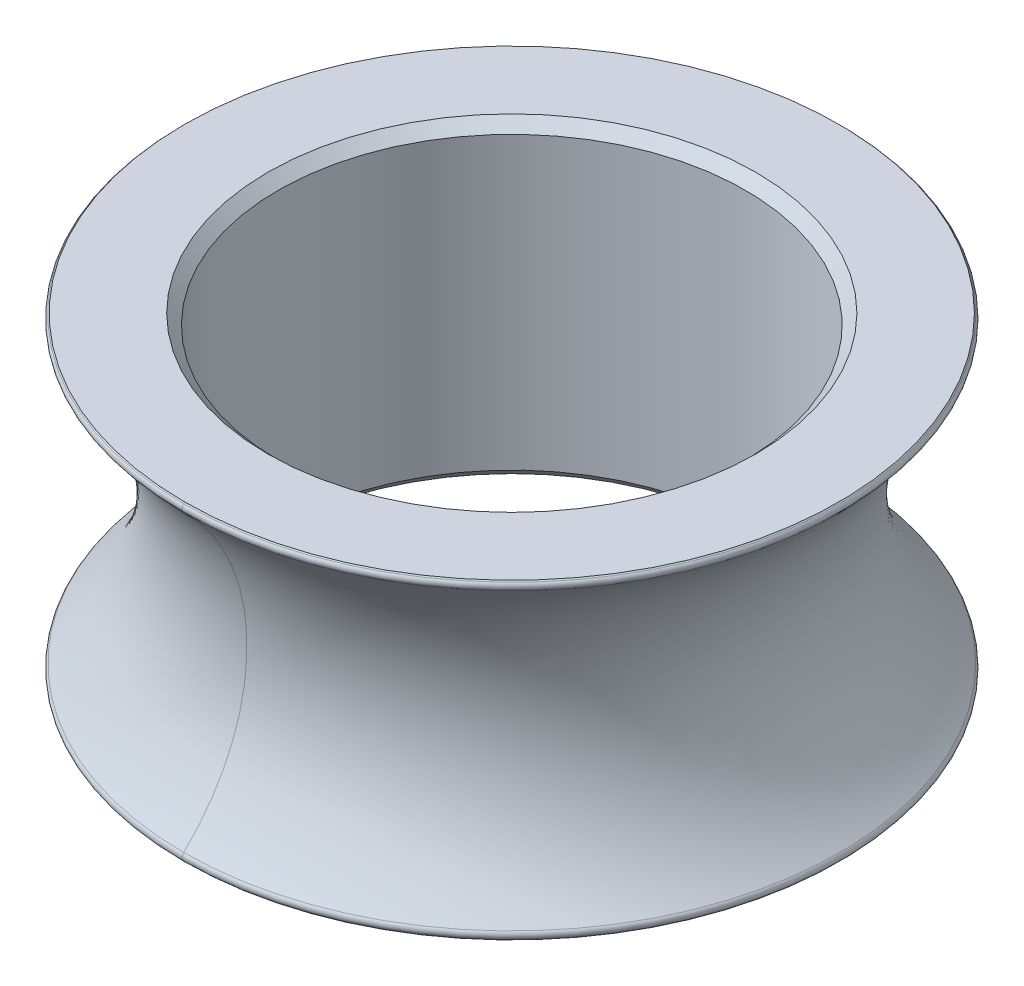
from build123d import *
from OCP.BRepFilletAPI import BRepFilletAPI_MakeChamfer

# Parameters (mm, degrees)
SKETCH1_R           = 6.499999999999999
SKETCH1_R_2         = 4.499999999999999
BOSS_EXTRUDE1_DEPTH = 3
CHAMFER1_SIZE       = 0.2
CHAMFER1_SIZE2      = 0.14196891191709868
CHAMFER2_SIZE       = 0.2
FILLET1_R           = 0.1


with BuildPart() as part:
    # Sketch1 → Boss-Extrude1 (new, symmetric)
    with BuildSketch(Plane(origin=(0, 0, 0), x_dir=(1, 0, 0), z_dir=(0, 1, 0))):
        Circle(SKETCH1_R)
        Circle(SKETCH1_R_2, mode=Mode.SUBTRACT)
    extrude(amount=BOSS_EXTRUDE1_DEPTH, both=True)

    # Cut-Sweep1: sweep along a curve in space
    with BuildLine() as cut_sweep1_path:
        ThreePointArc((0, 3, 6.499999999999999), (4.596194077712558, 3, 4.596194077712559), (6.499999999999999, 3, 0))
        ThreePointArc((6.499999999999999, 3, 0), (4.596194077712559, 3, -4.596194077712558), (0, 3, -6.499999999999999))
        ThreePointArc((0, 3, -6.499999999999999), (-4.596194077712558, 3, -4.596194077712559), (-6.499999999999999, 3, 0))
        ThreePointArc((-6.499999999999999, 3, 0), (-4.596194077712559, 3, 4.596194077712558), (0, 3, 6.499999999999999))
    # Sketch2 → Cut-Sweep1 (sweep, cut)
    with BuildSketch(Plane.XY):
        with BuildLine():
            Line((-6.499999999999999, 3), (-6.499999999999999, -3))
            ThreePointArc((-6.499999999999999, -3), (-5.099999999999998, -4.3e-16), (-6.499999999999999, 3))
        make_face()
    sweep(path=cut_sweep1_path.line, mode=Mode.SUBTRACT)

    # Chamfer1: one chamfer whose edges measure the first distance from different faces: ONE call of the kernel's chamfer builder (chamfer() names one face for all edges)
    chamfer1_edges_1 = [part.edges().sort_by_distance(p)[0] for p in [
        (6.500000000000001, -3, -2.18e-15),
        (6.500000000000001, -3, -2.18e-15),
    ]]
    chamfer1_side_1 = [part.faces().sort_by_distance(p)[0] for p in [
        (6.316152236891498, -3, -2.13e-15),
    ]]
    chamfer1_edges_2 = [part.edges().sort_by_distance(p)[0] for p in [
        (6.500000000000001, 3, -2.18e-15),
        (6.500000000000001, 3, -2.18e-15),
    ]]
    chamfer1_side_2 = [part.faces().sort_by_distance(p)[0] for p in [
        (6.316152236891498, 3, -2.13e-15),
    ]]
    chamfer1 = BRepFilletAPI_MakeChamfer(part.part.solid().wrapped)
    for e in chamfer1_edges_1:
        chamfer1.Add(CHAMFER1_SIZE, CHAMFER1_SIZE2, e.wrapped, chamfer1_side_1[0].wrapped)  # the first distance lies on this face
    for e in chamfer1_edges_2:
        chamfer1.Add(CHAMFER1_SIZE, CHAMFER1_SIZE2, e.wrapped, chamfer1_side_2[0].wrapped)  # the first distance lies on this face
    add(Compound.cast(chamfer1.Shape()), mode=Mode.REPLACE)

    # Chamfer2
    chamfer2_edges = [part.edges().sort_by_distance(p)[0] for p in [
        (-4.499999999999999, -3, -5.5e-16),
        (-4.499999999999999, 3, -5.5e-16),
    ]]
    chamfer(chamfer2_edges, length=CHAMFER2_SIZE)

    # Fillet1
    fillet1_edges = [part.edges().sort_by_distance(p)[0] for p in [
        (6.392863338762902, 2.906850079066638, -1.33e-15),
        (6.392863338762906, -2.9068500790666425, 1.243e-14),
        (6.392863338762902, 2.906850079066638, -1.33e-15),
        (6.392863338762906, -2.9068500790666425, 1.243e-14),
    ]]
    fillet(fillet1_edges, radius=FILLET1_R)


solid = part.part
